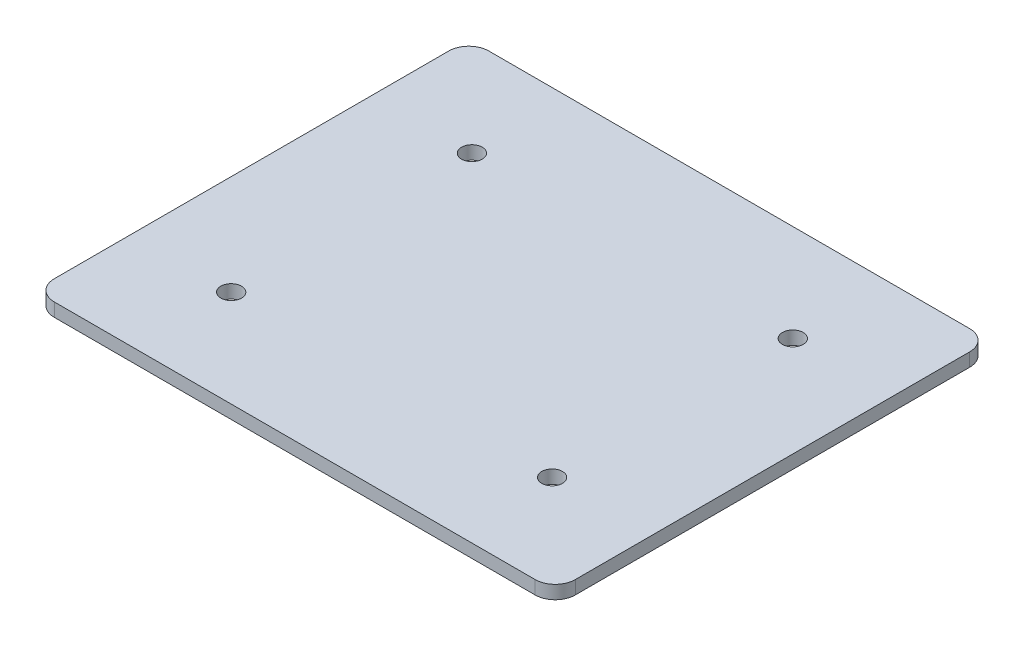
from build123d import *

# Parameters (mm, degrees)
SKETCH1_W               = 77.928270256
SKETCH1_H               = 65
BOSS_EXTRUDE1_DEPTH     = 2
CUT_EXTRUDE3_DEPTH      = 51.778477983
CUT_EXTRUDE3_DEPTH_BACK = 51.778477983
SKETCH2_R               = 1.55
FILLET1_R               = 3


with BuildPart() as part:
    # Sketch1 → Boss-Extrude1 (new body)
    with BuildSketch(Plane(origin=(0, 0, 0), x_dir=(1, 0, 0), z_dir=(0, 1, 0))):
        Rectangle(SKETCH1_W, SKETCH1_H)
    extrude(amount=BOSS_EXTRUDE1_DEPTH)

    # Sketch2 → Cut-Extrude3 (cut, two sides: drawn at the far end of the back side and taken through both)
    with BuildSketch(Plane(origin=(0, 2, 0), x_dir=(1, 0, 0), z_dir=(0, 1, 0)).offset(-CUT_EXTRUDE3_DEPTH_BACK)):
        with Locations((-24, 18)):
            Circle(SKETCH2_R)
        with Locations((24, 18)):
            Circle(SKETCH2_R)
        with Locations((24, -18)):
            Circle(SKETCH2_R)
        with Locations((-24, -18)):
            Circle(SKETCH2_R)
    extrude(amount=CUT_EXTRUDE3_DEPTH + CUT_EXTRUDE3_DEPTH_BACK, mode=Mode.SUBTRACT)

    # Fillet1
    fillet1_edges = [part.edges().sort_by_distance(p)[0] for p in [
        (-38.964135128, 1, 32.5),
        (38.964135128, 1, 32.5),
        (38.964135128, 1, -32.5),
        (-38.964135128, 1, -32.5),
    ]]
    fillet(fillet1_edges, radius=FILLET1_R)


solid = part.part
